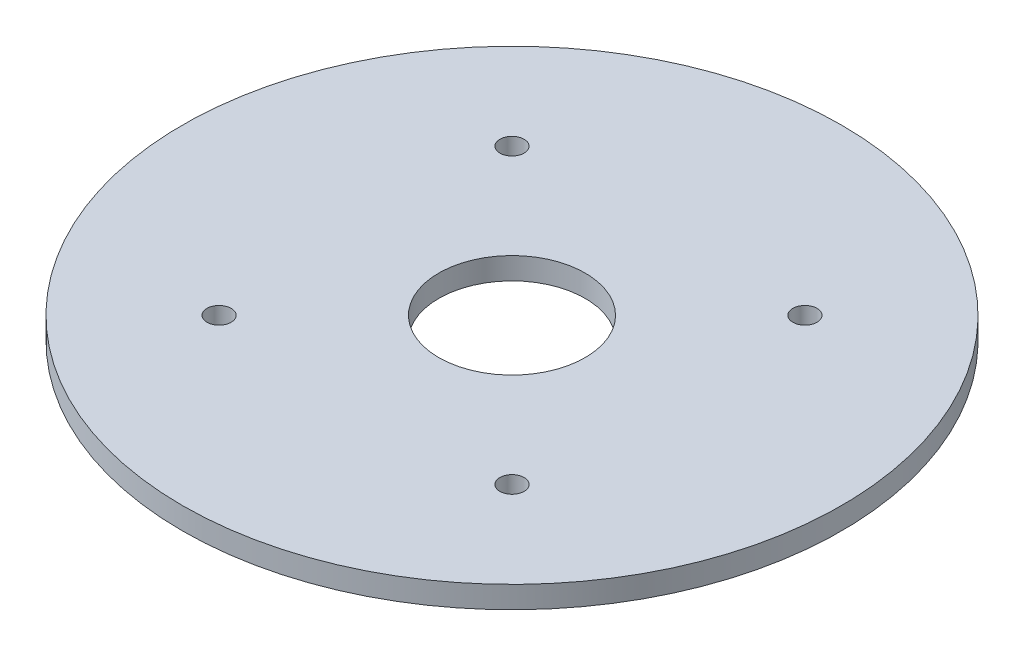
from build123d import *

# Parameters (mm, degrees)
SKETCH1_R           = 45
SKETCH1_R_2         = 10
BOSS_EXTRUDE1_DEPTH = 1.5
SKETCH2_R           = 1.65
CUT_EXTRUDE1_DEPTH  = 10


with BuildPart() as part:
    # Sketch1 → Boss-Extrude1 (new, symmetric)
    with BuildSketch(Plane(origin=(0, 0, 0), x_dir=(1, 0, 0), z_dir=(0, 1, 0))):
        Circle(SKETCH1_R)
        Circle(SKETCH1_R_2, mode=Mode.SUBTRACT)
    extrude(amount=BOSS_EXTRUDE1_DEPTH, both=True)

    # Sketch2 → Cut-Extrude1 (cut)
    with BuildSketch(Plane(origin=(0, 1.5, 0), x_dir=(1, 0, 0), z_dir=(0, 1, 0))):
        with Locations((-20, -20)):
            Circle(SKETCH2_R)
        with Locations((-20, 20)):
            Circle(SKETCH2_R)
        with Locations((20, 20)):
            Circle(SKETCH2_R)
        with Locations((20, -20)):
            Circle(SKETCH2_R)
    extrude(amount=-CUT_EXTRUDE1_DEPTH, mode=Mode.SUBTRACT)


solid = part.part
